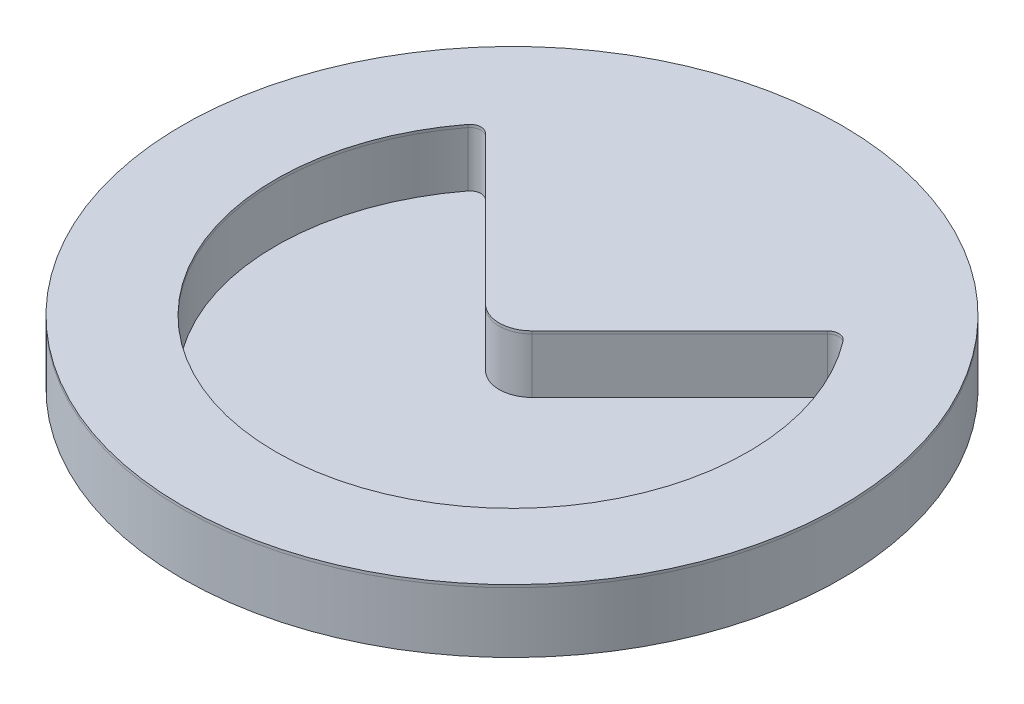
from build123d import *

# Parameters (mm, degrees)
SKETCH1_R             = 60
SKETCH1_R_2           = 58
EXTRUDE_THIN1_DEPTH   = 10
EXTRUDE_THIN1_2_DEPTH = 10
BOSS_EXTRUDE1_START   = -1
SKETCH2_R             = 60
BOSS_EXTRUDE1_DEPTH   = 1
SKETCH4_R             = 60
BOSS_EXTRUDE3_DEPTH   = 0.5


with BuildPart() as part:
    # Sketch1 → Extrude-Thin1 (new body)
    with BuildSketch(Plane(origin=(0, 0, 0), x_dir=(1, 0, 0), z_dir=(0, 1, 0))):
        Circle(SKETCH1_R)
        Circle(SKETCH1_R_2, mode=Mode.SUBTRACT)
    extrude(amount=EXTRUDE_THIN1_DEPTH)



with BuildPart() as body_2:
    # Sketch1 → Extrude-Thin1 2 (new body)
    with BuildSketch(Plane(origin=(0, 0, 0), x_dir=(1, 0, 0), z_dir=(0, 1, 0))):
        with BuildLine():
            Line((-29.737486768, 27.737486768), (-2.828427125, 0.828427125))
            ThreePointArc((-2.828427125, 0.828427125), (0, -0.343145751), (2.828427125, 0.828427125))
            Line((2.828427125, 0.828427125), (29.737486768, 27.737486768))
            ThreePointArc((29.737486768, 27.737486768), (32.830602007, 28.900292561), (35.743076224, 27.339211804))
            ThreePointArc((35.743076224, 27.339211804), (0, -45), (-35.743076224, 27.339211804))
            ThreePointArc((-35.743076224, 27.339211804), (-32.830602007, 28.900292561), (-29.737486768, 27.737486768))
        make_face()
        with BuildLine():
            Line((-31.151700331, 26.323273206), (-4.242640687, -0.585786438))
            ThreePointArc((-4.242640687, -0.585786438), (0, -2.343145751), (4.242640687, -0.585786438))
            Line((4.242640687, -0.585786438), (31.151700331, 26.323273206))
            ThreePointArc((31.151700331, 26.323273206), (32.69825795, 26.904676102), (34.154495058, 26.124135724))
            ThreePointArc((34.154495058, 26.124135724), (0, -43), (-34.154495058, 26.124135724))
            ThreePointArc((-34.154495058, 26.124135724), (-32.69825795, 26.904676102), (-31.151700331, 26.323273206))
        make_face(mode=Mode.SUBTRACT)
    extrude(amount=EXTRUDE_THIN1_2_DEPTH)


with BuildPart() as part_1:
    add(part.part)

    add(body_2.part)  # Boss-Extrude1 merges body 2
    # Sketch2 → Boss-Extrude1 (add)
    with BuildSketch(Plane(origin=(0, 0, 0), x_dir=(1, 0, 0), z_dir=(0, 1, 0)).offset(BOSS_EXTRUDE1_START)):
        Circle(SKETCH2_R)
    extrude(amount=BOSS_EXTRUDE1_DEPTH)


with BuildPart() as body_2_2:
    # Sketch4 → Boss-Extrude3 (new body)
    with BuildSketch(Plane(origin=(0, 10, 0), x_dir=(1, 0, 0), z_dir=(0, 1, 0))):
        Circle(SKETCH4_R)
        with BuildLine():
            Line((-4.242640687, -0.585786438), (-31.151700331, 26.323273206))
            ThreePointArc((-31.151700331, 26.323273206), (-32.69825795, 26.904676102), (-34.154495058, 26.124135724))
            ThreePointArc((-34.154495058, 26.124135724), (0, -43), (34.154495058, 26.124135724))
            ThreePointArc((34.154495058, 26.124135724), (32.69825795, 26.904676102), (31.151700331, 26.323273206))
            Line((31.151700331, 26.323273206), (4.242640687, -0.585786438))
            ThreePointArc((4.242640687, -0.585786438), (0, -2.343145751), (-4.242640687, -0.585786438))
        make_face(mode=Mode.SUBTRACT)
    extrude(amount=BOSS_EXTRUDE3_DEPTH)


solid = Compound([part_1.part, body_2_2.part])
